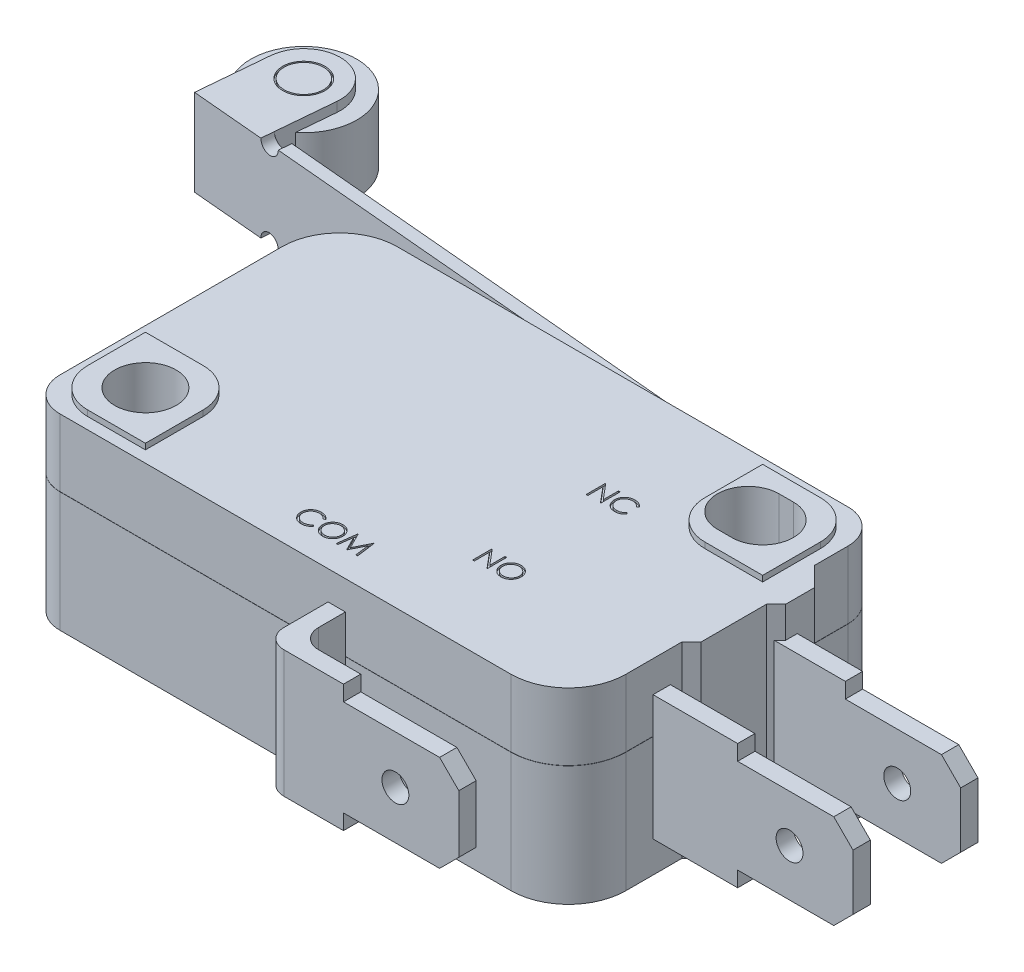
from build123d import *
from build123d.topology import SkipClean

# Parameters (mm, degrees)
SKETCH1_W                 = 28.2
SKETCH1_H                 = 16.3
BOSS_EXTRUDE1_DEPTH       = 9.75
FILLET1_R                 = 3
FILLET2_R                 = 1.75
CUT_EXTRUDE1_START        = -3.5
CUT_EXTRUDE1_DEPTH        = 0.01
SKETCH3_R                 = 1.6
CUT_EXTRUDE2_DEPTH        = 34.999889706
BOSS_EXTRUDE2_START       = 0.3
SKETCH4_R                 = 1.6
BOSS_EXTRUDE2_DEPTH       = 0.3
SKETCH5_R                 = 2.5
CUT_EXTRUDE3_DEPTH        = 0.1
CIRPATTERN1_COUNT         = 2
SKETCH6_R                 = 2.5
BOSS_EXTRUDE3_DEPTH       = 0.1
MIRROR1_START             = 0.3
MIRROR1_COPY_1_SKETCH_R   = 1.6
MIRROR1_COPY_1_DEPTH      = 0.3
BOSS_EXTRUDE4_START       = -9.75
BOSS_EXTRUDE4_DEPTH       = 9.75
SKETCH9_W                 = 0.9
SKETCH9_H                 = 6.5
BOSS_EXTRUDE5_DEPTH       = 4.4
SKETCH10_W                = 0.9
SKETCH10_H                = 4.9
BOSS_EXTRUDE6_DEPTH       = 6
CHAMFER1_SIZE             = 1
SKETCH11_R                = 0.7
CUT_EXTRUDE4_DEPTH        = 42.624181674
CUT_EXTRUDE5_DEPTH        = 44.159848239
BOSS_EXTRUDE7_START       = -1.5
BOSS_EXTRUDE7_DEPTH       = 6.6
CUT_EXTRUDE6_REACH        = 46.442
CUT_EXTRUDE7_REACH        = 46.442
SKETCH15_R                = 0.7
SKETCH16_W                = 3
SKETCH16_H                = 4
BOSS_EXTRUDE8_DEPTH       = 2.75
FILLET3_R                 = 1.5
BOSS_EXTRUDE10_DEPTH      = 2.25
BOSS_EXTRUDE10_DEPTH_BACK = 2.25
BOSS_EXTRUDE11_DEPTH      = 4.5
CUT_EXTRUDE8_REACH        = 46.735
SKETCH20_R                = 0.5
BOSS_EXTRUDE12_DEPTH      = 1.75
BOSS_EXTRUDE12_DEPTH_BACK = 1.75
SKETCH21_R                = 2.75
SKETCH22_R                = 1.1
SKETCH22_R_2              = 1.019987299
CUT_EXTRUDE9_DEPTH        = 0.1
CUT_EXTRUDE10_DEPTH       = 0.1


with BuildPart() as part:
    # Sketch1 → Boss-Extrude1 (new body)
    with BuildSketch(Plane(origin=(0, 0, 0), x_dir=(1, 0, 0), z_dir=(0, 1, 0))):
        with Locations((14.1, 8.15)):
            Rectangle(SKETCH1_W, SKETCH1_H)
    extrude(amount=BOSS_EXTRUDE1_DEPTH)

    # Fillet1
    fillet1_edges = [part.edges().sort_by_distance(p)[0] for p in [
        (0, 4.875, -16.3),
        (28.2, 4.875, 0),
    ]]
    fillet(fillet1_edges, radius=FILLET1_R)

    # Fillet2
    fillet2_edges = [part.edges().sort_by_distance(p)[0] for p in [
        (28.2, 4.875, -16.3),
        (0, 4.875, 0),
    ]]
    fillet(fillet2_edges, radius=FILLET2_R)

    # Sketch2 → Cut-Extrude1 (cut)
    with BuildSketch(Plane(origin=(0, 9.75, 0), x_dir=(1, 0, 0), z_dir=(0, 1, 0)).offset(CUT_EXTRUDE1_START)):
        with BuildLine():
            Line((26.45, 16.3), (3, 16.3))
            ThreePointArc((3, 16.3), (0.878679656, 15.421320344), (0, 13.3))
            Line((0, 13.3), (0, 1.75))
            ThreePointArc((0, 1.75), (0.512563133, 0.512563133), (1.75, 0))
            Line((1.75, 0), (25.2, 0))
            ThreePointArc((25.2, 0), (27.321320344, 0.878679656), (28.2, 3))
            Line((28.2, 3), (28.2, 14.55))
            ThreePointArc((28.2, 14.55), (27.687436867, 15.787436867), (26.45, 16.3))
        make_face()
        with BuildLine():
            Line((26.45, 16.2), (3, 16.2))
            ThreePointArc((3, 16.2), (0.949390335, 15.350609665), (0.1, 13.3))
            Line((0.1, 13.3), (0.1, 1.75))
            ThreePointArc((0.1, 1.75), (0.583273811, 0.583273811), (1.75, 0.1))
            Line((1.75, 0.1), (25.2, 0.1))
            ThreePointArc((25.2, 0.1), (27.250609665, 0.949390335), (28.1, 3))
            Line((28.1, 3), (28.1, 14.55))
            ThreePointArc((28.1, 14.55), (27.616726189, 15.716726189), (26.45, 16.2))
        make_face(mode=Mode.SUBTRACT)
    extrude(amount=-CUT_EXTRUDE1_DEPTH, mode=Mode.SUBTRACT)

    # Sketch3 → Cut-Extrude2 (cut, through all)
    with BuildSketch(Plane(origin=(0, 9.75, 0), x_dir=(1, 0, 0), z_dir=(0, 1, 0))):
        with Locations(Location((3.1, 3.1, 0), (0, 0, 270))):
            Circle(SKETCH3_R)
        with Locations(Location((25.1, 13.2, 0), (0, 0, 270))):
            Circle(SKETCH3_R)
    extrude(amount=-CUT_EXTRUDE2_DEPTH, mode=Mode.SUBTRACT)

    # Sketch4 → Boss-Extrude2 (add)
    with BuildSketch(Plane(origin=(0, 9.75, 0), x_dir=(1, 0, 0), z_dir=(0, 1, 0)).offset(BOSS_EXTRUDE2_START)):
        with BuildLine():
            Line((0.6, 5.6), (3.6, 5.6))
            ThreePointArc((3.6, 5.6), (5.014213562, 5.014213562), (5.6, 3.6))
            Line((5.6, 3.6), (5.6, 0.6))
            Line((5.6, 0.6), (2.6, 0.6))
            ThreePointArc((2.6, 0.6), (1.185786438, 1.185786438), (0.6, 2.6))
            Line((0.6, 2.6), (0.6, 5.6))
        make_face()
        with Locations(Location((3.1, 3.1, 0), (0, 0, 270))):
            Circle(SKETCH4_R, mode=Mode.SUBTRACT)
    boss_extrude2 = extrude(amount=-BOSS_EXTRUDE2_DEPTH)

    # Sketch5 → Cut-Extrude3 (cut)
    with BuildSketch(Plane(origin=(0, 9.75, 0), x_dir=(1, 0, 0), z_dir=(0, 1, 0))):
        with Locations(Location((14.1, 8.15, 0), (0, 0, 270))):
            Circle(SKETCH5_R)
    extrude(amount=-CUT_EXTRUDE3_DEPTH, mode=Mode.SUBTRACT)

    # CirPattern1: Boss-Extrude2 ×2 about axis
    cirpattern1_axis = Axis((14.1, 0, -8.15), (0, 1, 0))
    for i in range(1, CIRPATTERN1_COUNT):
        add(boss_extrude2.rotate(cirpattern1_axis, i * 360 / CIRPATTERN1_COUNT))

    # Sketch6 → Boss-Extrude3 (add)
    with SkipClean():  # the faces are left unmerged after this step: merging them gives an invalid solid
        with BuildSketch(Plane(origin=(0, 9.75, 0), x_dir=(1, 0, 0), z_dir=(0, 1, 0))):
            with Locations((14.1, 8.15)):
                Circle(SKETCH6_R)
        extrude(amount=-BOSS_EXTRUDE3_DEPTH)

    # Mirror1: Boss-Extrude2 across plane
    with SkipClean():  # the faces are left unmerged after this step: merging them gives an invalid solid
        add(boss_extrude2.mirror(Plane(origin=(0, 4.875, 0), x_dir=(0, 0, 1), z_dir=(0, -1, 0))))

    # Mirror1 copy 1 sketch → Mirror1 copy 1 (add)
    with SkipClean():  # the faces are left unmerged after this step: merging them gives an invalid solid
        with BuildSketch(Plane(origin=(28.2, 0, -16.3), x_dir=(-1, 0, 0), z_dir=(0, -1, 0)).offset(MIRROR1_START)):
            with BuildLine():
                Line((0.6, -5.6), (3.6, -5.6))
                ThreePointArc((3.6, -5.6), (5.014213562, -5.014213562), (5.6, -3.6))
                Line((5.6, -3.6), (5.6, -0.6))
                Line((5.6, -0.6), (2.6, -0.6))
                ThreePointArc((2.6, -0.6), (1.185786438, -1.185786438), (0.6, -2.6))
                Line((0.6, -2.6), (0.6, -5.6))
            make_face()
            with Locations((3.1, -3.1)):
                Circle(MIRROR1_COPY_1_SKETCH_R, mode=Mode.SUBTRACT)
        extrude(amount=-MIRROR1_COPY_1_DEPTH)
    add(part.part.scale(1), mode=Mode.REPLACE)  # the faces are merged on a copy

    # Sketch8 → Boss-Extrude4 (add)
    with BuildSketch(Plane(origin=(0, 9.75, 0), x_dir=(1, 0, 0), z_dir=(0, 1, 0)).offset(BOSS_EXTRUDE4_START)):
        Polygon((28.2, 5.9), (28.2, 12.8), (29.2, 11.8), (29.2, 10.3), (28.7, 9.8), (28.7, 6.4), align=None)
    extrude(amount=BOSS_EXTRUDE4_DEPTH)

    # Sketch9 → Boss-Extrude5 (add)
    with BuildSketch(Plane(origin=(28.2, 0, 0), x_dir=(0, 0, -1), z_dir=(1, 0, 0))):
        with Locations((4.85, 4.875)):
            Rectangle(SKETCH9_W, SKETCH9_H)
        with Locations((10.45, 4.875)):
            Rectangle(SKETCH9_W, SKETCH9_H)
    extrude(amount=BOSS_EXTRUDE5_DEPTH)

    # Sketch10 → Boss-Extrude6 (add)
    with BuildSketch(Plane(origin=(32.6, 0, 0), x_dir=(0, 0, -1), z_dir=(1, 0, 0))):
        with Locations((4.85, 4.875)):
            Rectangle(SKETCH10_W, SKETCH10_H)
        with Locations((10.45, 4.875)):
            Rectangle(SKETCH10_W, SKETCH10_H)
    extrude(amount=BOSS_EXTRUDE6_DEPTH)

    # Chamfer1
    chamfer1_edges = [part.edges().sort_by_distance(p)[0] for p in [
        (38.6, 2.425, -10.45),
        (38.6, 7.325, -10.45),
        (38.6, 2.425, -4.85),
        (38.6, 7.325, -4.85),
    ]]
    chamfer(chamfer1_edges, length=CHAMFER1_SIZE)

    # Sketch11 → Cut-Extrude4 (cut, through all)
    with BuildSketch(Plane.XY.offset(-4.4)):
        with Locations((35.3, 4.875)):
            Circle(SKETCH11_R)
    extrude(amount=-CUT_EXTRUDE4_DEPTH, mode=Mode.SUBTRACT)

    # Sketch12 → Cut-Extrude5 (cut, through all)
    with BuildSketch(Plane(origin=(0, 10.05, 0), x_dir=(1, 0, 0), z_dir=(0, 1, 0))):
        with BuildLine():
            Line((25.1, 11.6), (24.35, 11.6))
            ThreePointArc((24.35, 11.6), (22.75, 13.2), (24.35, 14.8))
            Line((24.35, 14.8), (25.1, 14.8))
            ThreePointArc((25.1, 14.8), (26.7, 13.2), (25.1, 11.6))
        make_face()
    extrude(amount=-CUT_EXTRUDE5_DEPTH, mode=Mode.SUBTRACT)

    # Sketch13 → Boss-Extrude7 (add)
    with BuildSketch(Plane(origin=(0, 9.75, 0), x_dir=(1, 0, 0), z_dir=(0, 1, 0)).offset(BOSS_EXTRUDE7_START)):
        with BuildLine():
            Line((15.7, 0), (15.7, -2.3))
            ThreePointArc((15.7, -2.3), (15.992893219, -3.007106781), (16.7, -3.3))
            Line((16.7, -3.3), (25.8, -3.3))
            Line((25.8, -3.3), (25.8, -2.4))
            Line((25.8, -2.4), (17.6, -2.4))
            ThreePointArc((17.6, -2.4), (16.892893219, -2.107106781), (16.6, -1.4))
            Line((16.6, -1.4), (16.6, 0))
            Line((16.6, 0), (15.7, 0))
        make_face()
    extrude(amount=-BOSS_EXTRUDE7_DEPTH)

    # Sketch14 → Cut-Extrude6 (cut, up to next)
    with BuildSketch(Plane.XY.offset(3.3), mode=Mode.PRIVATE) as cut_extrude6_sk1:
        Polygon((19.8, 8.25), (19.8, 7.45), (24.8, 7.45), (25.8, 6.45), (25.8, 8.25), align=None)
    cut_extrude6_tool1 = extrude(cut_extrude6_sk1.sketch, amount=-CUT_EXTRUDE6_REACH, mode=Mode.PRIVATE) & part.part
    # Sketch14 → Cut-Extrude6 (cut, up to next)
    with BuildSketch(Plane.XY.offset(3.3), mode=Mode.PRIVATE) as cut_extrude6_sk2:
        Polygon((25.8, 3.45), (24.8, 2.45), (19.8, 2.45), (19.8, 1.65), (25.8, 1.65), align=None)
    cut_extrude6_tool2 = extrude(cut_extrude6_sk2.sketch, amount=-CUT_EXTRUDE6_REACH, mode=Mode.PRIVATE) & part.part
    add(cut_extrude6_tool1.solids().sort_by_distance((23.051572, 7.780818, 3.3))[0], mode=Mode.SUBTRACT)
    add(cut_extrude6_tool2.solids().sort_by_distance((23.051572, 2.119182, 3.3))[0], mode=Mode.SUBTRACT)

    # Sketch15 → Cut-Extrude7 (cut, up to next)
    with BuildSketch(Plane.XY.offset(3.3), mode=Mode.PRIVATE) as cut_extrude7_sk1:
        with Locations((22.5, 4.95)):
            Circle(SKETCH15_R)
    cut_extrude7_tool1 = extrude(cut_extrude7_sk1.sketch, amount=-CUT_EXTRUDE7_REACH, mode=Mode.PRIVATE) & part.part
    add(cut_extrude7_tool1.solids().sort_by_distance((22.5, 4.95, 3.3))[0], mode=Mode.SUBTRACT)

    # Sketch16 → Boss-Extrude8 (add)
    with BuildSketch(Plane(origin=(0, 0, -16.3), x_dir=(-1, 0, 0), z_dir=(0, 0, -1))):
        with Locations((-5.5, 4.875)):
            Rectangle(SKETCH16_W, SKETCH16_H)
    extrude(amount=BOSS_EXTRUDE8_DEPTH)

    # Fillet3
    fillet3_edges = [part.edges().sort_by_distance(p)[0] for p in [
        (7, 4.875, -19.05),
        (4, 4.875, -19.05),
    ]]
    fillet(fillet3_edges, radius=FILLET3_R - 0.0001)  # a hair under: the kernel refuses the full size

    # Sketch17 → Boss-Extrude10 (add, two sides: drawn at the far end of the back side and taken through both)
    with BuildSketch(Plane(origin=(0, 4.875, 0), x_dir=(-1, 0, 0), z_dir=(0, -1, 0)).offset(-BOSS_EXTRUDE10_DEPTH_BACK)):
        with BuildLine():
            Line((-16.2, 16.3), (-16.2, 17.844431919))
            ThreePointArc((-16.2, 17.844431919), (-15.937814148, 18.519435832), (-15.288739434, 18.840486793))
            Line((-15.288739434, 18.840486793), (11.793213636, 21.253242612))
            Line((11.793213636, 21.253242612), (11.850894268, 20.605806944))
            Line((11.850894268, 20.605806944), (-14.638739434, 18.245821396))
            ThreePointArc((-14.638739434, 18.245821396), (-15.287814148, 17.924770435), (-15.55, 17.249766521))
            Line((-15.55, 17.249766521), (-15.55, 16.3))
            Line((-15.55, 16.3), (-16.2, 16.3))
        make_face()
    extrude(amount=BOSS_EXTRUDE10_DEPTH + BOSS_EXTRUDE10_DEPTH_BACK)

    # Sketch19 → Boss-Extrude11 (add)
    with BuildSketch(Plane(origin=(0, 7.125, 0), x_dir=(1, 0, 0), z_dir=(0, 1, 0))):
        with BuildLine():
            Line((-11.793213636, 21.253242612), (-11.526995333, 24.241407235))
            ThreePointArc((-11.526995333, 24.241407235), (-9.465886147, 25.965306572), (-7.74198681, 23.904197385))
            Line((-7.74198681, 23.904197385), (-8.008205113, 20.916032762))
            Line((-8.008205113, 20.916032762), (-11.793213636, 21.253242612))
        make_face()
    extrude(amount=-BOSS_EXTRUDE11_DEPTH)

    # Sketch20 → Cut-Extrude8 (cut, up to next)
    with BuildSketch(Plane(origin=(1.785692348, 0, -20.043485534), x_dir=(-0.9960548743952071, 0, -0.08873943426430067), z_dir=(0.08873943426430067, 0, -0.9960548743952071)), mode=Mode.PRIVATE) as cut_extrude8_sk1:
        with Locations((9.332688652, 7.125)):
            Circle(SKETCH20_R)
    cut_extrude8_tool1 = extrude(cut_extrude8_sk1.sketch, amount=-CUT_EXTRUDE8_REACH, mode=Mode.PRIVATE) & part.part
    # Sketch20 → Cut-Extrude8 (cut, up to next)
    with BuildSketch(Plane(origin=(1.785692348, 0, -20.043485534), x_dir=(-0.9960548743952071, 0, -0.08873943426430067), z_dir=(0.08873943426430067, 0, -0.9960548743952071)), mode=Mode.PRIVATE) as cut_extrude8_sk2:
        with Locations((9.332688652, 2.625)):
            Circle(SKETCH20_R)
    cut_extrude8_tool2 = extrude(cut_extrude8_sk2.sketch, amount=-CUT_EXTRUDE8_REACH, mode=Mode.PRIVATE) & part.part
    add(cut_extrude8_tool1.solids().sort_by_distance((-7.510178, 7.125, -20.871663))[0], mode=Mode.SUBTRACT)
    add(cut_extrude8_tool2.solids().sort_by_distance((-7.510178, 2.625, -20.871663))[0], mode=Mode.SUBTRACT)

    # Sketch21 → Boss-Extrude12 (add, two sides: drawn at the far end of the back side and taken through both)
    with BuildSketch(Plane(origin=(0, 4.875, 0), x_dir=(-1, 0, 0), z_dir=(0, -1, 0)).offset(-BOSS_EXTRUDE12_DEPTH_BACK)):
        with Locations((9.634491072, 24.07280231)):
            Circle(SKETCH21_R)
    extrude(amount=BOSS_EXTRUDE12_DEPTH + BOSS_EXTRUDE12_DEPTH_BACK)

    # Sketch22 → Cut-Extrude9 (cut)
    with BuildSketch(Plane(origin=(0, 7.125, 0), x_dir=(1, 0, 0), z_dir=(0, 1, 0))):
        with Locations(Location((-9.634491072, 24.07280231, 0), (0, 0, 270))):
            Circle(SKETCH22_R)
        with Locations(Location((-9.634491072, 24.07280231, 0), (0, 0, 270))):
            Circle(SKETCH22_R_2, mode=Mode.SUBTRACT)
    cut_extrude9 = extrude(amount=-CUT_EXTRUDE9_DEPTH, mode=Mode.SUBTRACT)

    # Mirror2: Cut-Extrude9 across plane
    add(cut_extrude9.mirror(Plane(origin=(0, 4.875, 0), x_dir=(0, 0, 1), z_dir=(0, -1, 0))), mode=Mode.SUBTRACT)

    # Sketch23 → Cut-Extrude10 (cut)
    # profile 1 of 7: a face of its own
    with BuildSketch(Plane(origin=(0, 9.75, 0), x_dir=(1, 0, 0), z_dir=(0, 1, 0))):
        Polygon((19.06892598, 10.05012242), (19.06892598, 11.05012242), (19.087756108, 11.05012242), (19.748413159, 10.263063125), (19.748413159, 11.05012242), (19.838156749, 11.05012242), (19.838156749, 10.05012242), (19.817724057, 10.05012242), (19.158669569, 10.83537883), (19.158669569, 10.05012242), align=None)
    # profile 2 of 7: a face of its own
    with BuildSketch(Plane(origin=(0, 9.75, 0), x_dir=(1, 0, 0), z_dir=(0, 1, 0))):
        with BuildLine():
            Line((21.017643928, 10.86662883), (20.939118287, 10.806532676))
            add(Edge.make_bspline(
                [(20.939118287, 10.806532676), (20.933516605, 10.813208668), (20.922388763, 10.826470644), (20.904486134, 10.845093371), (20.885828521, 10.862540588), (20.866423058, 10.878895411), (20.845920453, 10.893585915), (20.824817367, 10.907377659), (20.802760783, 10.91973987), (20.772260287, 10.934729294), (20.732360902, 10.950371053), (20.682133805, 10.963486262), (20.629702063, 10.971835169), (20.59393132, 10.97273941), (20.575736877, 10.973199343)],
                knots=[0, 0, 0, 0, 0.757959112, 1.505699292, 2.245454638, 2.979532153, 3.711538275, 4.438200793, 5.171680507, 5.909471876, 7.393775596, 8.890124382, 10.418191784, 12, 12, 12, 12], degree=3))
            add(Edge.make_bspline(
                [(20.575736877, 10.973199343), (20.565713077, 10.973083925), (20.545758508, 10.972854161), (20.516144658, 10.969822982), (20.487083787, 10.965562636), (20.458594796, 10.959241115), (20.430713951, 10.951248938), (20.403258979, 10.94169882), (20.376627379, 10.929883152), (20.35045074, 10.916823649), (20.325370965, 10.90207295), (20.301640951, 10.885983421), (20.279347246, 10.868735108), (20.258472214, 10.850263363), (20.238994515, 10.830651374), (20.221055283, 10.809690134), (20.204716594, 10.787446656), (20.189654587, 10.764214254), (20.176165235, 10.740060599), (20.164870984, 10.714896293), (20.15486952, 10.689152264), (20.146955451, 10.662537646), (20.140691303, 10.635239713), (20.136369114, 10.607185202), (20.133372407, 10.578432722), (20.133143785, 10.558944347), (20.133028544, 10.549120817)],
                knots=[0, 0, 0, 0, 1.054917814, 2.100044995, 3.131103042, 4.146048494, 5.169673617, 6.183595914, 7.203665975, 8.234915748, 9.262203917, 10.264457458, 11.251630812, 12.227803204, 13.197192746, 14.159520551, 15.12972552, 16.100847026, 17.073214652, 18.039054194, 19.002613845, 19.979014051, 20.95965708, 21.949030935, 22.966165397, 24, 24, 24, 24], degree=3))
            add(Edge.make_bspline(
                [(20.133028544, 10.549120817), (20.133389063, 10.53434044), (20.134096896, 10.50532113), (20.14039642, 10.462815241), (20.149969303, 10.422095049), (20.164316611, 10.383415094), (20.182007768, 10.34629842), (20.204362229, 10.311373034), (20.230252668, 10.278111158), (20.260045359, 10.247298887), (20.292732735, 10.219152109), (20.327803567, 10.194366228), (20.365170507, 10.173704833), (20.404420972, 10.156511706), (20.445857005, 10.143295498), (20.489404091, 10.133991462), (20.534967518, 10.127922268), (20.566101633, 10.127341214), (20.581946813, 10.127045497)],
                knots=[0, 0, 0, 0, 1.029171465, 2.020641659, 2.987623507, 3.938342917, 4.889210282, 5.84687017, 6.821220943, 7.821438502, 8.827599549, 9.822697543, 10.807740252, 11.797342354, 12.80366471, 13.83203677, 14.896651826, 16, 16, 16, 16], degree=3))
            add(Edge.make_bspline(
                [(20.581946813, 10.127045497), (20.599404724, 10.127528005), (20.633766069, 10.128477697), (20.684156934, 10.136523197), (20.732395724, 10.149568317), (20.778485035, 10.167824866), (20.822294934, 10.191557805), (20.86389398, 10.220328627), (20.903317285, 10.254411008), (20.927023366, 10.280434759), (20.939118287, 10.293712163)],
                knots=[0, 0, 0, 0, 1.028121516, 2.023589091, 2.998037872, 3.967518031, 4.937445131, 5.927275754, 6.942489185, 8, 8, 8, 8], degree=3))
            Line((20.939118287, 10.293712163), (21.017643928, 10.234216971))
            add(Edge.make_bspline(
                [(21.017643928, 10.234216971), (21.011324468, 10.226063128), (20.998715818, 10.209794497), (20.978299242, 10.186859723), (20.956791443, 10.165287142), (20.934032668, 10.145250678), (20.910284728, 10.126349402), (20.88512121, 10.109120308), (20.858872915, 10.093322912), (20.831628778, 10.078858077), (20.803417746, 10.066024578), (20.774273622, 10.055037787), (20.744322029, 10.045573533), (20.713561598, 10.037787265), (20.681928525, 10.031709812), (20.64953696, 10.027647048), (20.616316996, 10.024863644), (20.593905162, 10.024609954), (20.582547774, 10.024481394)],
                knots=[0, 0, 0, 0, 0.986787822, 1.968848986, 2.935600012, 3.899624008, 4.868462664, 5.837806735, 6.815139263, 7.798259679, 8.787526145, 9.778297419, 10.776456485, 11.791383307, 12.812564526, 13.85620153, 14.913611965, 16, 16, 16, 16], degree=3))
            add(Edge.make_bspline(
                [(20.582547774, 10.024481394), (20.571792441, 10.024556249), (20.550525101, 10.024704266), (20.519125458, 10.027102028), (20.488557006, 10.030373381), (20.458907113, 10.035299133), (20.430013977, 10.041111802), (20.402139524, 10.048903589), (20.375009464, 10.057631922), (20.348732796, 10.06789049), (20.323287167, 10.079466542), (20.29875465, 10.092549845), (20.275146526, 10.107030378), (20.252230692, 10.122588952), (20.230345668, 10.139725324), (20.209301803, 10.158201505), (20.188981096, 10.177955223), (20.1764089, 10.192199466), (20.170087839, 10.199361202)],
                knots=[0, 0, 0, 0, 1.114604814, 2.203992996, 3.262667896, 4.300477797, 5.318619304, 6.316056647, 7.298880507, 8.271930387, 9.238335007, 10.195173496, 11.151986948, 12.108099108, 13.064862484, 14.031167946, 15.010108607, 16, 16, 16, 16], degree=3))
            add(Edge.make_bspline(
                [(20.170087839, 10.199361202), (20.159963369, 10.211801542), (20.139836661, 10.23653203), (20.114086466, 10.276613739), (20.092044307, 10.318461799), (20.074222616, 10.362296064), (20.060290406, 10.408018175), (20.050638636, 10.455651179), (20.044366749, 10.505150591), (20.043649524, 10.538818245), (20.043284954, 10.555931715)],
                knots=[0, 0, 0, 0, 0.994628077, 1.977248131, 2.950237994, 3.925870899, 4.908910175, 5.911660606, 6.938484602, 8, 8, 8, 8], degree=3))
            add(Edge.make_bspline(
                [(20.043284954, 10.555931715), (20.043729295, 10.573918987), (20.044603508, 10.609307823), (20.052030878, 10.661243238), (20.063979106, 10.71100078), (20.080949645, 10.758487565), (20.10246546, 10.803953359), (20.129044493, 10.847050846), (20.160377962, 10.888055646), (20.196220124, 10.926345575), (20.235525077, 10.961356819), (20.277616167, 10.992158591), (20.322411009, 11.017792167), (20.369416109, 11.039219642), (20.418983447, 11.055689489), (20.471007266, 11.067218971), (20.525389814, 11.074395289), (20.562493364, 11.075302492), (20.581345851, 11.075763445)],
                knots=[0, 0, 0, 0, 1.032925535, 2.032216505, 3.007276963, 3.968222605, 4.92396291, 5.891752235, 6.871517503, 7.883894988, 8.900124299, 9.891468569, 10.874487609, 11.85992873, 12.854644235, 13.869047385, 14.917252991, 16, 16, 16, 16], degree=3))
            add(Edge.make_bspline(
                [(20.581345851, 11.075763445), (20.592835701, 11.075625692), (20.6155787, 11.075353022), (20.649222315, 11.072694124), (20.681977265, 11.068261665), (20.713866117, 11.062228503), (20.745044008, 11.054740696), (20.775272648, 11.044986325), (20.804729416, 11.033833031), (20.833228532, 11.020987755), (20.860633261, 11.006568686), (20.886935066, 10.990735651), (20.911925026, 10.973508278), (20.935778982, 10.955033085), (20.9580979, 10.93491921), (20.979515465, 10.913719897), (20.999304345, 10.890824519), (21.011519543, 10.874708824), (21.017643928, 10.86662883)],
                knots=[0, 0, 0, 0, 1.096760587, 2.17092713, 3.219439832, 4.250915756, 5.268269357, 6.278326846, 7.281116186, 8.274029601, 9.260640565, 10.235837813, 11.203064059, 12.156899882, 13.114053108, 14.069676657, 15.032185724, 16, 16, 16, 16], degree=3))
        make_face()
    # profile 3 of 7: a face of its own
    with BuildSketch(Plane(origin=(0, 9.75, 0), x_dir=(1, 0, 0), z_dir=(0, 1, 0))):
        Polygon((19.06892598, 4.148483372), (19.06892598, 5.148483372), (19.087756108, 5.148483372), (19.748413159, 4.361424077), (19.748413159, 5.148483372), (19.838156749, 5.148483372), (19.838156749, 4.148483372), (19.817724057, 4.148483372), (19.158669569, 4.933739782), (19.158669569, 4.148483372), align=None)
    # profile 4 of 7: a face of its own
    with BuildSketch(Plane(origin=(0, 9.75, 0), x_dir=(1, 0, 0), z_dir=(0, 1, 0))):
        with BuildLine():
            add(Edge.make_bspline(
                [(20.562515723, 5.174124397), (20.581032325, 5.173655403), (20.617400458, 5.17273426), (20.670850429, 5.165683088), (20.721877599, 5.153484405), (20.770897639, 5.137237839), (20.817324204, 5.115565157), (20.861506744, 5.0893694), (20.903340137, 5.058376126), (20.942260532, 5.022824919), (20.977876803, 4.984143932), (21.009255628, 4.942864529), (21.035553426, 4.8992363), (21.057149365, 4.853390348), (21.074091825, 4.805430357), (21.08578298, 4.755100642), (21.093251023, 4.702727302), (21.094124102, 4.667005341), (21.094567005, 4.648884013)],
                knots=[0, 0, 0, 0, 1.065120563, 2.091984664, 3.0946048, 4.079830382, 5.057816894, 6.036188127, 7.030412546, 8.04752943, 9.064399622, 10.05169764, 11.02544977, 11.989514704, 12.962713494, 13.945757189, 14.957906945, 16, 16, 16, 16], degree=3))
            add(Edge.make_bspline(
                [(21.094567005, 4.648884013), (21.094124167, 4.630896171), (21.093251283, 4.595440051), (21.085774489, 4.543399067), (21.074048489, 4.493373154), (21.057306699, 4.445445824), (21.035813705, 4.39956652), (21.009340799, 4.355855962), (20.978157596, 4.31429982), (20.942669924, 4.275353344), (20.903983912, 4.239639781), (20.86248955, 4.208520102), (20.81912003, 4.181741781), (20.773317256, 4.160375017), (20.725688674, 4.143297325), (20.675808011, 4.131653717), (20.623908995, 4.124143133), (20.58851728, 4.1232807), (20.570528544, 4.122842346)],
                knots=[0, 0, 0, 0, 1.043624062, 2.057103931, 3.04512605, 4.022047818, 4.998200453, 5.980619268, 6.982898556, 8.009068085, 9.034988726, 10.034168286, 11.015286542, 11.987931943, 12.962482838, 13.94673481, 14.956375938, 16, 16, 16, 16], degree=3))
            add(Edge.make_bspline(
                [(20.570528544, 4.122842346), (20.55240731, 4.123285028), (20.516685534, 4.124157672), (20.464246381, 4.131638073), (20.413881311, 4.143335589), (20.365734354, 4.160052571), (20.319778659, 4.181657494), (20.27592435, 4.208001602), (20.234347451, 4.239260785), (20.195392666, 4.274736949), (20.159750038, 4.313357393), (20.128675931, 4.354738609), (20.102325898, 4.398068739), (20.080793518, 4.443468032), (20.063746529, 4.490717015), (20.052116581, 4.540130866), (20.044592024, 4.591427868), (20.043724925, 4.62635441), (20.043284954, 4.644076321)],
                knots=[0, 0, 0, 0, 1.053102029, 2.075944431, 3.073151272, 4.055350789, 5.033113405, 6.020478099, 7.024410459, 8.052272461, 9.079885166, 10.07527673, 11.055994387, 12.023226415, 12.992069828, 13.970394897, 14.97016774, 16, 16, 16, 16], degree=3))
            add(Edge.make_bspline(
                [(20.043284954, 4.644076321), (20.043437707, 4.655971369), (20.043741286, 4.679611404), (20.047396055, 4.714716147), (20.052699398, 4.749256335), (20.060299945, 4.783133749), (20.070240421, 4.816265459), (20.081969572, 4.848879962), (20.096295242, 4.88064674), (20.112489713, 4.911716281), (20.130564515, 4.941604254), (20.150529015, 4.969855564), (20.171681977, 4.996707277), (20.194871518, 5.021463564), (20.21933336, 5.044844608), (20.245464325, 5.066491099), (20.273104966, 5.086598228), (20.302374218, 5.104718325), (20.332550868, 5.121106649), (20.363658518, 5.135170035), (20.395274682, 5.147240339), (20.427547438, 5.157023432), (20.460391087, 5.16474687), (20.493877312, 5.170006114), (20.527979433, 5.173670205), (20.550954096, 5.173972349), (20.562515723, 5.174124397)],
                knots=[0, 0, 0, 0, 1.037015668, 2.060948919, 3.074880161, 4.083647147, 5.086022904, 6.090072063, 7.104153813, 8.122640571, 9.144368836, 10.147691507, 11.138137339, 12.123020368, 13.103399296, 14.087645067, 15.080126199, 16.082011238, 17.087798457, 18.072939717, 19.057185487, 20.037253025, 21.01195951, 21.997135196, 22.992090687, 24, 24, 24, 24], degree=3))
        make_face()
        with BuildLine():
            add(Edge.make_bspline(
                [(20.566922774, 5.071560295), (20.557432879, 5.071444612), (20.538543813, 5.071214352), (20.510462517, 5.06818129), (20.482750535, 5.063858465), (20.455402146, 5.057692316), (20.428531778, 5.049291158), (20.401888966, 5.039622327), (20.375716665, 5.027844873), (20.350101277, 5.014538386), (20.325268398, 4.999810123), (20.301836198, 4.983532475), (20.279744014, 4.966087174), (20.259045938, 4.947433506), (20.239802746, 4.927476477), (20.221635688, 4.906518638), (20.205272951, 4.883960955), (20.190277072, 4.860415124), (20.176857689, 4.835911816), (20.16492473, 4.810708998), (20.155163585, 4.784601087), (20.147202906, 4.757871328), (20.14060296, 4.730562054), (20.136421839, 4.702466097), (20.13335545, 4.673724636), (20.133138352, 4.654301249), (20.133028544, 4.644476962)],
                knots=[0, 0, 0, 0, 1.008559885, 2.007477868, 2.99961109, 3.989939068, 4.984837346, 5.991145699, 7.001802488, 8.033829008, 9.059044045, 10.069351652, 11.065060232, 12.050310815, 13.029377138, 14.011219647, 14.996725999, 15.989392538, 16.977580475, 17.965360261, 18.951710183, 19.937753436, 20.929683414, 21.935841486, 22.955955122, 24, 24, 24, 24], degree=3))
            add(Edge.make_bspline(
                [(20.133028544, 4.644476962), (20.13339279, 4.630030613), (20.134109375, 4.601610176), (20.140382967, 4.559962134), (20.150046388, 4.51993691), (20.16429135, 4.481753507), (20.182105811, 4.445083712), (20.204113494, 4.410252825), (20.230187518, 4.377251432), (20.259805669, 4.346309927), (20.292183585, 4.318068269), (20.326564365, 4.293278723), (20.362579681, 4.272304366), (20.400323454, 4.255217203), (20.439594179, 4.241677277), (20.480644908, 4.232397669), (20.523202182, 4.226290396), (20.552210941, 4.225703894), (20.566922774, 4.225406449)],
                knots=[0, 0, 0, 0, 1.032063989, 2.030389145, 3.003944642, 3.970395727, 4.937377036, 5.913328081, 6.909231446, 7.93887556, 8.970685674, 9.976071282, 10.964166581, 11.944589148, 12.933237628, 13.927779006, 14.949070134, 16, 16, 16, 16], degree=3))
            add(Edge.make_bspline(
                [(20.566922774, 4.225406449), (20.576811204, 4.225542307), (20.596422928, 4.225811755), (20.625593077, 4.228525663), (20.654237709, 4.232877625), (20.682316646, 4.239143527), (20.709798021, 4.246985586), (20.736796536, 4.25630208), (20.763024619, 4.267925281), (20.788813144, 4.280767553), (20.813497785, 4.295407598), (20.837062223, 4.311132783), (20.858912503, 4.328552389), (20.879595094, 4.346928907), (20.898917291, 4.366632864), (20.91674843, 4.387638641), (20.933028467, 4.410078829), (20.948018652, 4.433588945), (20.961391013, 4.458159303), (20.973042184, 4.483453497), (20.982926789, 4.509409242), (20.990906361, 4.536063977), (20.99715935, 4.563367077), (21.001467899, 4.591355099), (21.004481739, 4.619972054), (21.004708904, 4.639327441), (21.004823416, 4.649084333)],
                knots=[0, 0, 0, 0, 1.047197238, 2.076906641, 3.100256066, 4.114471768, 5.12198147, 6.126382909, 7.136867548, 8.15857795, 9.17633901, 10.174870724, 11.156907918, 12.133735059, 13.104061851, 14.077631395, 15.04955518, 16.038496417, 17.029181396, 18.010275684, 18.986308667, 19.968651475, 20.955262928, 21.950658345, 22.966943676, 24, 24, 24, 24], degree=3))
            add(Edge.make_bspline(
                [(21.004823416, 4.649084333), (21.004708812, 4.658774477), (21.004481474, 4.677996663), (21.001469339, 4.70641404), (20.997154799, 4.734200672), (20.990936882, 4.761247473), (20.982922552, 4.787561337), (20.973040458, 4.813117551), (20.961387515, 4.838011321), (20.948013737, 4.86218112), (20.932980644, 4.885373902), (20.916553718, 4.90754602), (20.898449333, 4.928281089), (20.879184754, 4.948091001), (20.858278787, 4.966553256), (20.835826131, 4.983673976), (20.812099366, 4.99986634), (20.786977299, 5.014473643), (20.761050455, 5.027963424), (20.734446467, 5.039520853), (20.707466724, 5.049341459), (20.680179835, 5.057717735), (20.652356127, 5.063834315), (20.624183604, 5.068185186), (20.595701245, 5.071213296), (20.576546039, 5.071444262), (20.566922774, 5.071560295)],
                knots=[0, 0, 0, 0, 1.02996197, 2.043119294, 3.035359645, 4.018872909, 4.991431989, 5.957985074, 6.929999688, 7.912076566, 8.892894881, 9.867085534, 10.843653904, 11.817741046, 12.803660682, 13.806313499, 14.818574707, 15.856120519, 16.894564902, 17.924820532, 18.937903209, 19.946497019, 20.957711757, 21.963978472, 22.977135795, 24, 24, 24, 24], degree=3))
        make_face(mode=Mode.SUBTRACT)
    # profile 5 of 7: a face of its own
    with BuildSketch(Plane(origin=(0, 9.75, 0), x_dir=(1, 0, 0), z_dir=(0, 1, 0))):
        with BuildLine():
            Line((13.418395052, 2.160250433), (13.339869411, 2.100154279))
            add(Edge.make_bspline(
                [(13.339869411, 2.100154279), (13.334267729, 2.10683027), (13.323139887, 2.120092246), (13.305237258, 2.138714973), (13.286579645, 2.156162191), (13.267174182, 2.172517013), (13.246671577, 2.187207518), (13.225568491, 2.200999261), (13.203511907, 2.213361472), (13.173011411, 2.228350897), (13.133112026, 2.243992655), (13.082884929, 2.257107864), (13.030453187, 2.265456772), (12.994682444, 2.266361012), (12.976488001, 2.266820945)],
                knots=[0, 0, 0, 0, 0.757959112, 1.505699292, 2.245454638, 2.979532153, 3.711538275, 4.438200793, 5.171680507, 5.909471876, 7.393775596, 8.890124382, 10.418191784, 12, 12, 12, 12], degree=3))
            add(Edge.make_bspline(
                [(12.976488001, 2.266820945), (12.966464201, 2.266705527), (12.946509632, 2.266475763), (12.916895782, 2.263444584), (12.88783491, 2.259184239), (12.85934592, 2.252862718), (12.831465075, 2.244870541), (12.804010103, 2.235320423), (12.777378503, 2.223504754), (12.751201863, 2.210445251), (12.726122089, 2.195694553), (12.702392075, 2.179605024), (12.68009837, 2.16235671), (12.659223338, 2.143884966), (12.639745638, 2.124272977), (12.621806407, 2.103311736), (12.605467718, 2.081068258), (12.590405711, 2.057835856), (12.576916359, 2.033682201), (12.565622107, 2.008517896), (12.555620644, 1.982773866), (12.547706575, 1.956159249), (12.541442427, 1.928861316), (12.537120237, 1.900806805), (12.534123531, 1.872054325), (12.533894909, 1.85256595), (12.533779668, 1.84274242)],
                knots=[0, 0, 0, 0, 1.054917814, 2.100044995, 3.131103042, 4.146048494, 5.169673617, 6.183595914, 7.203665975, 8.234915748, 9.262203917, 10.264457458, 11.251630812, 12.227803204, 13.197192746, 14.159520551, 15.12972552, 16.100847026, 17.073214652, 18.039054194, 19.002613845, 19.979014051, 20.95965708, 21.949030935, 22.966165397, 24, 24, 24, 24], degree=3))
            add(Edge.make_bspline(
                [(12.533779668, 1.84274242), (12.534140187, 1.827962043), (12.53484802, 1.798942733), (12.541147544, 1.756436844), (12.550720427, 1.715716651), (12.565067735, 1.677036696), (12.582758892, 1.639920023), (12.605113353, 1.604994636), (12.631003792, 1.57173276), (12.660796483, 1.54092049), (12.693483859, 1.512773711), (12.728554691, 1.487987831), (12.76592163, 1.467326436), (12.805172096, 1.450133308), (12.846608129, 1.4369171), (12.890155215, 1.427613065), (12.935718642, 1.42154387), (12.966852757, 1.420962817), (12.982697937, 1.420667099)],
                knots=[0, 0, 0, 0, 1.029171465, 2.020641659, 2.987623507, 3.938342917, 4.889210282, 5.84687017, 6.821220943, 7.821438502, 8.827599549, 9.822697543, 10.807740252, 11.797342354, 12.80366471, 13.83203677, 14.896651826, 16, 16, 16, 16], degree=3))
            add(Edge.make_bspline(
                [(12.982697937, 1.420667099), (13.000155848, 1.421149608), (13.034517193, 1.4220993), (13.084908058, 1.4301448), (13.133146848, 1.443189919), (13.179236159, 1.461446468), (13.223046058, 1.485179408), (13.264645103, 1.51395023), (13.304068409, 1.548032611), (13.32777449, 1.574056361), (13.339869411, 1.587333766)],
                knots=[0, 0, 0, 0, 1.028121516, 2.023589091, 2.998037872, 3.967518031, 4.937445131, 5.927275754, 6.942489185, 8, 8, 8, 8], degree=3))
            Line((13.339869411, 1.587333766), (13.418395052, 1.527838574))
            add(Edge.make_bspline(
                [(13.418395052, 1.527838574), (13.412075592, 1.51968473), (13.399466942, 1.5034161), (13.379050366, 1.480481326), (13.357542567, 1.458908744), (13.334783792, 1.438872281), (13.311035852, 1.419971005), (13.285872334, 1.40274191), (13.259624039, 1.386944515), (13.232379902, 1.372479679), (13.20416887, 1.35964618), (13.175024746, 1.348659389), (13.145073153, 1.339195135), (13.114312722, 1.331408867), (13.082679648, 1.325331415), (13.050288084, 1.321268651), (13.01706812, 1.318485247), (12.994656285, 1.318231556), (12.983298898, 1.318102997)],
                knots=[0, 0, 0, 0, 0.986787822, 1.968848986, 2.935600012, 3.899624008, 4.868462664, 5.837806735, 6.815139263, 7.798259679, 8.787526145, 9.778297419, 10.776456485, 11.791383307, 12.812564526, 13.85620153, 14.913611965, 16, 16, 16, 16], degree=3))
            add(Edge.make_bspline(
                [(12.983298898, 1.318102997), (12.972543565, 1.318177852), (12.951276225, 1.318325868), (12.919876582, 1.32072363), (12.88930813, 1.323994984), (12.859658237, 1.328920735), (12.830765101, 1.334733404), (12.802890648, 1.342525192), (12.775760588, 1.351253525), (12.749483919, 1.361512093), (12.724038291, 1.373088145), (12.699505773, 1.386171447), (12.67589765, 1.40065198), (12.652981815, 1.416210554), (12.631096791, 1.433346926), (12.610052927, 1.451823108), (12.58973222, 1.471576825), (12.577160024, 1.485821069), (12.570838962, 1.492982804)],
                knots=[0, 0, 0, 0, 1.114604814, 2.203992996, 3.262667896, 4.300477797, 5.318619304, 6.316056647, 7.298880507, 8.271930387, 9.238335007, 10.195173496, 11.151986948, 12.108099108, 13.064862484, 14.031167946, 15.010108607, 16, 16, 16, 16], degree=3))
            add(Edge.make_bspline(
                [(12.570838962, 1.492982804), (12.560714493, 1.505423144), (12.540587785, 1.530153633), (12.51483759, 1.570235342), (12.492795431, 1.612083401), (12.47497374, 1.655917667), (12.46104153, 1.701639777), (12.45138976, 1.749272781), (12.445117873, 1.798772193), (12.444400648, 1.832439847), (12.444036078, 1.849553317)],
                knots=[0, 0, 0, 0, 0.994628077, 1.977248131, 2.950237994, 3.925870899, 4.908910175, 5.911660606, 6.938484602, 8, 8, 8, 8], degree=3))
            add(Edge.make_bspline(
                [(12.444036078, 1.849553317), (12.444480419, 1.86754059), (12.445354632, 1.902929425), (12.452782002, 1.95486484), (12.46473023, 2.004622383), (12.481700769, 2.052109167), (12.503216584, 2.097574961), (12.529795616, 2.140672449), (12.561129086, 2.181677248), (12.596971248, 2.219967177), (12.636276201, 2.254978421), (12.67836729, 2.285780193), (12.723162132, 2.311413769), (12.770167233, 2.332841244), (12.819734571, 2.349311091), (12.87175839, 2.360840573), (12.926140937, 2.368016892), (12.963244488, 2.368924094), (12.982096975, 2.369385048)],
                knots=[0, 0, 0, 0, 1.032925535, 2.032216505, 3.007276963, 3.968222605, 4.92396291, 5.891752235, 6.871517503, 7.883894988, 8.900124299, 9.891468569, 10.874487609, 11.85992873, 12.854644235, 13.869047385, 14.917252991, 16, 16, 16, 16], degree=3))
            add(Edge.make_bspline(
                [(12.982096975, 2.369385048), (12.993586824, 2.369247294), (13.016329824, 2.368974624), (13.049973439, 2.366315727), (13.082728389, 2.361883268), (13.114617241, 2.355850105), (13.145795132, 2.348362299), (13.176023772, 2.338607928), (13.205480539, 2.327454633), (13.233979656, 2.314609357), (13.261384385, 2.300190288), (13.28768619, 2.284357253), (13.31267615, 2.26712988), (13.336530106, 2.248654687), (13.358849024, 2.228540813), (13.380266589, 2.2073415), (13.400055469, 2.184446121), (13.412270667, 2.168330426), (13.418395052, 2.160250433)],
                knots=[0, 0, 0, 0, 1.096760587, 2.17092713, 3.219439832, 4.250915756, 5.268269357, 6.278326846, 7.281116186, 8.274029601, 9.260640565, 10.235837813, 11.203064059, 12.156899882, 13.114053108, 14.069676657, 15.032185724, 16, 16, 16, 16], degree=3))
        make_face()
    # profile 6 of 7: a face of its own
    with BuildSketch(Plane(origin=(0, 9.75, 0), x_dir=(1, 0, 0), z_dir=(0, 1, 0))):
        with BuildLine():
            add(Edge.make_bspline(
                [(14.091471975, 2.369385048), (14.109988577, 2.368916054), (14.14635671, 2.367994911), (14.199806681, 2.360943738), (14.250833851, 2.348745055), (14.299853891, 2.332498489), (14.346280456, 2.310825807), (14.390462996, 2.284630051), (14.432296389, 2.253636777), (14.471216784, 2.218085569), (14.506833055, 2.179404582), (14.53821188, 2.138125179), (14.564509678, 2.09449695), (14.586105617, 2.048650999), (14.603048077, 2.000691008), (14.614739232, 1.950361293), (14.622207275, 1.897987953), (14.623080355, 1.862265991), (14.623523257, 1.844144663)],
                knots=[0, 0, 0, 0, 1.065120563, 2.091984664, 3.0946048, 4.079830382, 5.057816894, 6.036188127, 7.030412546, 8.04752943, 9.064399622, 10.05169764, 11.02544977, 11.989514704, 12.962713494, 13.945757189, 14.957906945, 16, 16, 16, 16], degree=3))
            add(Edge.make_bspline(
                [(14.623523257, 1.844144663), (14.623080419, 1.826156821), (14.622207535, 1.790700701), (14.614730741, 1.738659717), (14.603004741, 1.688633804), (14.586262951, 1.640706475), (14.564769957, 1.594827171), (14.538297051, 1.551116612), (14.507113848, 1.50956047), (14.471626176, 1.470613994), (14.432940164, 1.434900431), (14.391445802, 1.403780752), (14.348076282, 1.377002431), (14.302273508, 1.355635667), (14.254644926, 1.338557976), (14.204764263, 1.326914367), (14.152865247, 1.319403783), (14.117473532, 1.31854135), (14.099484796, 1.318102997)],
                knots=[0, 0, 0, 0, 1.043624062, 2.057103931, 3.04512605, 4.022047818, 4.998200453, 5.980619268, 6.982898556, 8.009068085, 9.034988726, 10.034168286, 11.015286542, 11.987931943, 12.962482838, 13.94673481, 14.956375938, 16, 16, 16, 16], degree=3))
            add(Edge.make_bspline(
                [(14.099484796, 1.318102997), (14.081363562, 1.318545679), (14.045641786, 1.319418323), (13.993202633, 1.326898724), (13.942837563, 1.338596239), (13.894690606, 1.355313221), (13.848734912, 1.376918144), (13.804880602, 1.403262252), (13.763303703, 1.434521436), (13.724348918, 1.4699976), (13.68870629, 1.508618043), (13.657632183, 1.549999259), (13.63128215, 1.593329389), (13.60974977, 1.638728682), (13.592702781, 1.685977666), (13.581072833, 1.735391516), (13.573548276, 1.786688518), (13.572681177, 1.82161506), (13.572241206, 1.839336971)],
                knots=[0, 0, 0, 0, 1.053102029, 2.075944431, 3.073151272, 4.055350789, 5.033113405, 6.020478099, 7.024410459, 8.052272461, 9.079885166, 10.07527673, 11.055994387, 12.023226415, 12.992069828, 13.970394897, 14.97016774, 16, 16, 16, 16], degree=3))
            add(Edge.make_bspline(
                [(13.572241206, 1.839336971), (13.572393959, 1.851232019), (13.572697538, 1.874872055), (13.576352307, 1.909976797), (13.58165565, 1.944516985), (13.589256197, 1.978394399), (13.599196673, 2.011526109), (13.610925824, 2.044140613), (13.625251494, 2.075907391), (13.641445965, 2.106976931), (13.659520767, 2.136864905), (13.679485267, 2.165116214), (13.700638229, 2.191967927), (13.72382777, 2.216724214), (13.748289612, 2.240105259), (13.774420577, 2.261751749), (13.802061218, 2.281858878), (13.83133047, 2.299978976), (13.86150712, 2.3163673), (13.89261477, 2.330430686), (13.924230934, 2.342500989), (13.95650369, 2.352284082), (13.989347339, 2.360007521), (14.022833564, 2.365266765), (14.056935685, 2.368930856), (14.079910348, 2.369232999), (14.091471975, 2.369385048)],
                knots=[0, 0, 0, 0, 1.037015668, 2.060948919, 3.074880161, 4.083647147, 5.086022904, 6.090072063, 7.104153813, 8.122640571, 9.144368836, 10.147691507, 11.138137339, 12.123020368, 13.103399296, 14.087645067, 15.080126199, 16.082011238, 17.087798457, 18.072939717, 19.057185487, 20.037253025, 21.01195951, 21.997135196, 22.992090687, 24, 24, 24, 24], degree=3))
        make_face()
        with BuildLine():
            add(Edge.make_bspline(
                [(14.095879027, 2.266820945), (14.086389131, 2.266705262), (14.067500065, 2.266475002), (14.039418769, 2.263441941), (14.011706788, 2.259119115), (13.984358398, 2.252952967), (13.95748803, 2.244551809), (13.930845218, 2.234882978), (13.904672917, 2.223105523), (13.879057529, 2.209799036), (13.854224651, 2.195070773), (13.83079245, 2.178793126), (13.808700266, 2.161347824), (13.78800219, 2.142694157), (13.768758998, 2.122737127), (13.75059194, 2.101779289), (13.734229203, 2.079221605), (13.719233324, 2.055675775), (13.705813941, 2.031172466), (13.693880982, 2.005969648), (13.684119837, 1.979861738), (13.676159158, 1.953131978), (13.669559212, 1.925822704), (13.665378091, 1.897726747), (13.662311702, 1.868985287), (13.662094604, 1.8495619), (13.661984796, 1.839737612)],
                knots=[0, 0, 0, 0, 1.008559885, 2.007477868, 2.99961109, 3.989939068, 4.984837346, 5.991145699, 7.001802488, 8.033829008, 9.059044045, 10.069351652, 11.065060232, 12.050310815, 13.029377138, 14.011219647, 14.996725999, 15.989392538, 16.977580475, 17.965360261, 18.951710183, 19.937753436, 20.929683414, 21.935841486, 22.955955122, 24, 24, 24, 24], degree=3))
            add(Edge.make_bspline(
                [(13.661984796, 1.839737612), (13.662349042, 1.825291263), (13.663065627, 1.796870826), (13.669339219, 1.755222785), (13.67900264, 1.71519756), (13.693247602, 1.677014158), (13.711062063, 1.640344362), (13.733069746, 1.605513475), (13.75914377, 1.572512083), (13.788761921, 1.541570577), (13.821139837, 1.513328919), (13.855520617, 1.488539374), (13.891535933, 1.467565017), (13.929279706, 1.450477853), (13.968550431, 1.436937928), (14.00960116, 1.427658319), (14.052158434, 1.421551046), (14.081167193, 1.420964544), (14.095879027, 1.420667099)],
                knots=[0, 0, 0, 0, 1.032063989, 2.030389145, 3.003944642, 3.970395727, 4.937377036, 5.913328081, 6.909231446, 7.93887556, 8.970685674, 9.976071282, 10.964166581, 11.944589148, 12.933237628, 13.927779006, 14.949070134, 16, 16, 16, 16], degree=3))
            add(Edge.make_bspline(
                [(14.095879027, 1.420667099), (14.105767456, 1.420802958), (14.12537918, 1.421072406), (14.15454933, 1.423786313), (14.183193961, 1.428138276), (14.211272899, 1.434404178), (14.238754273, 1.442246237), (14.265752788, 1.45156273), (14.291980871, 1.463185931), (14.317769396, 1.476028203), (14.342454037, 1.490668248), (14.366018475, 1.506393434), (14.387868755, 1.52381304), (14.408551347, 1.542189558), (14.427873543, 1.561893514), (14.445704682, 1.582899292), (14.461984719, 1.60533948), (14.476974904, 1.628849595), (14.490347265, 1.653419953), (14.501998436, 1.678714147), (14.511883041, 1.704669893), (14.519862613, 1.731324627), (14.526115603, 1.758627727), (14.530424151, 1.786615749), (14.533437991, 1.815232704), (14.533665156, 1.834588092), (14.533779668, 1.844344984)],
                knots=[0, 0, 0, 0, 1.047197238, 2.076906641, 3.100256066, 4.114471768, 5.12198147, 6.126382909, 7.136867548, 8.15857795, 9.17633901, 10.174870724, 11.156907918, 12.133735059, 13.104061851, 14.077631395, 15.04955518, 16.038496417, 17.029181396, 18.010275684, 18.986308667, 19.968651475, 20.955262928, 21.950658345, 22.966943676, 24, 24, 24, 24], degree=3))
            add(Edge.make_bspline(
                [(14.533779668, 1.844344984), (14.533665064, 1.854035128), (14.533437726, 1.873257314), (14.530425591, 1.90167469), (14.526111051, 1.929461322), (14.519893134, 1.956508123), (14.511878804, 1.982821987), (14.50199671, 2.008378201), (14.490343767, 2.033271971), (14.476969989, 2.05744177), (14.461936896, 2.080634552), (14.44550997, 2.10280667), (14.427405585, 2.123541739), (14.408141006, 2.143351652), (14.387235039, 2.161813906), (14.364782383, 2.178934626), (14.341055618, 2.19512699), (14.315933551, 2.209734294), (14.290006707, 2.223224074), (14.263402719, 2.234781504), (14.236422976, 2.244602109), (14.209136087, 2.252978385), (14.181312379, 2.259094965), (14.153139857, 2.263445837), (14.124657497, 2.266473947), (14.105502291, 2.266704912), (14.095879027, 2.266820945)],
                knots=[0, 0, 0, 0, 1.02996197, 2.043119294, 3.035359645, 4.018872909, 4.991431989, 5.957985074, 6.929999688, 7.912076566, 8.892894881, 9.867085534, 10.843653904, 11.817741046, 12.803660682, 13.806313499, 14.818574707, 15.856120519, 16.894564902, 17.924820532, 18.937903209, 19.946497019, 20.957711757, 21.963978472, 22.977135795, 24, 24, 24, 24], degree=3))
        make_face(mode=Mode.SUBTRACT)
    # profile 7 of 7: a face of its own
    with BuildSketch(Plane(origin=(0, 9.75, 0), x_dir=(1, 0, 0), z_dir=(0, 1, 0))):
        Polygon((14.777369411, 1.343744022), (14.909380629, 2.343744022), (14.922201142, 2.343744022), (15.335061719, 1.523231202), (15.746920693, 2.343744022), (15.759941527, 2.343744022), (15.892754027, 1.343744022), (15.802609796, 1.343744022), (15.706856591, 2.063295304), (15.345879027, 1.343744022), (15.325646655, 1.343744022), (14.963266847, 2.064897868), (14.867713962, 1.343744022), align=None)
    extrude(amount=-CUT_EXTRUDE10_DEPTH, mode=Mode.SUBTRACT)


solid = part.part
